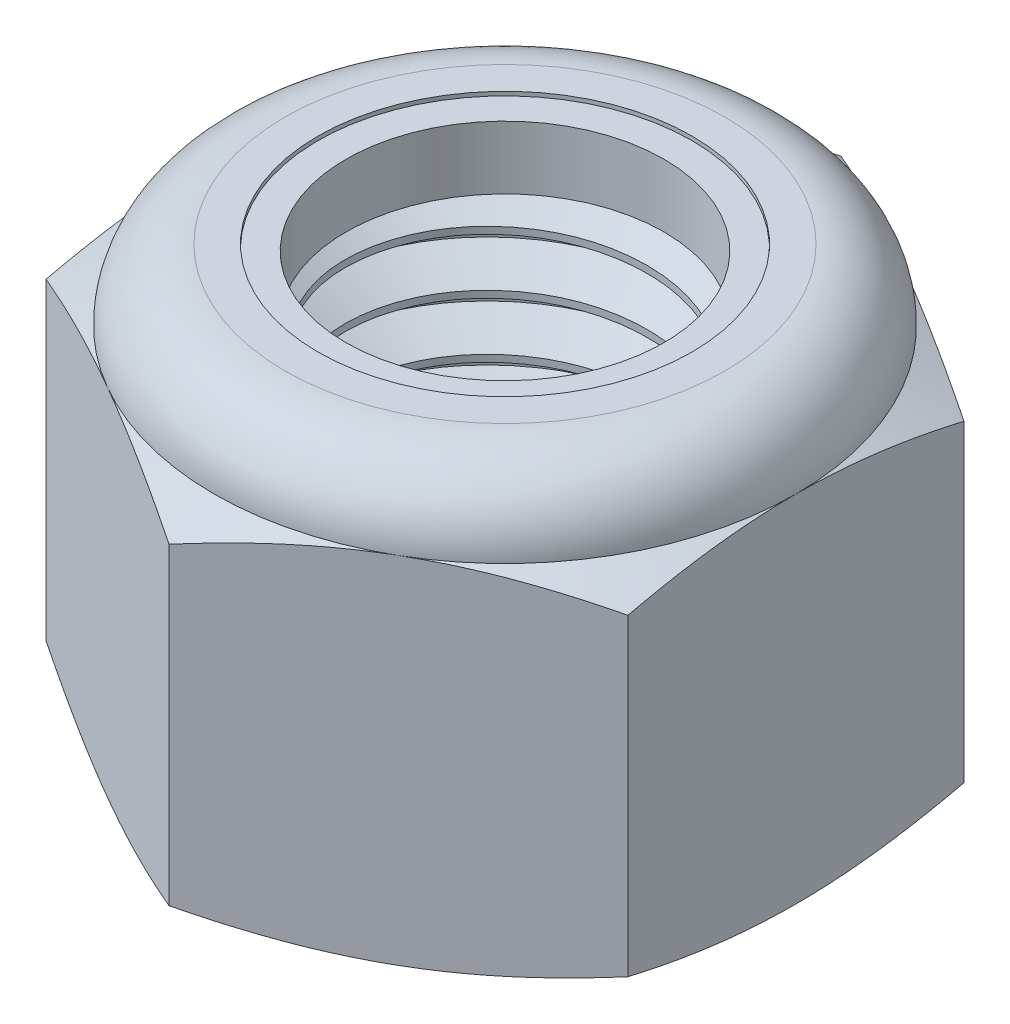
from build123d import *

# Parameters (mm, degrees)
SKETCH1_R        = 7.14375
EXTRUDE1_DEPTH   = 16.271875
SKETCH2_W        = 7.14375
SKETCH2_H        = 13.559895833
CUT_SWEEP1_PITCH = 2.116666667
SKETCH12_W       = 7.858125
SKETCH12_H       = 13.559895833


with BuildPart() as part:
    # Sketch1 → Extrude1 (new body)
    with BuildSketch(Plane(origin=(0, 0, 0), x_dir=(1, 0, 0), z_dir=(0, 1, 0))):
        Polygon((0, 12.831609733), (-11.1125, 6.415804866), (-11.1125, -6.415804866), (0, -12.831609733), (11.1125, -6.415804866), (11.1125, 6.415804866), align=None)
        with Locations(Location((0, 0, 0), (0, 0, 270))):
            Circle(SKETCH1_R, mode=Mode.SUBTRACT)
    extrude(amount=EXTRUDE1_DEPTH)

    # Sketch5 → Cut-Revolve3 (revolve, cut)
    with BuildSketch(Plane(origin=(0, 0, 0), x_dir=(0, 0, -1), z_dir=(1, 0, 0))):
        with BuildLine():
            Line((0, 0), (11.1125, 0))
            Line((11.1125, 0), (12.831609733, 0.801634034))
            Line((12.831609733, 0.801634034), (12.831609733, 12.7582618))
            Line((12.831609733, 12.7582618), (11.1125, 13.559895833))
            ThreePointArc((11.1125, 13.559895833), (10.318179693, 15.477554693), (8.400520833, 16.271875))
            Line((8.400520833, 16.271875), (8.400520833, 17.541875))
            Line((8.400520833, 17.541875), (14.101609733, 17.541875))
            Line((14.101609733, 17.541875), (14.101609733, -1.27))
            Line((14.101609733, -1.27), (0, -1.27))
            Line((0, -1.27), (0, 0))
        make_face()
    revolve(axis=Axis((0, 0, 0), (0, 1, 0)), mode=Mode.SUBTRACT)

    # Sketch6 → Cut-Revolve4 (revolve, cut)
    with BuildSketch(Plane(origin=(0, 0, 0), x_dir=(0, 0, -1), z_dir=(1, 0, 0)), mode=Mode.PRIVATE) as cut_revolve4_sk:
        with BuildLine():
            Line((0, 13.559895833), (10.9601, 13.559895833))
            ThreePointArc((10.9601, 13.559895833), (10.210416619, 15.369791619), (8.400520833, 16.119475))
            Line((8.400520833, 16.119475), (4.200260417, 16.119475))
            Line((4.200260417, 16.119475), (4.200260417, 17.541875))
            Line((4.200260417, 17.541875), (0, 17.541875))
            Line((0, 17.541875), (0, 13.559895833))
        make_face()
    revolve(cut_revolve4_sk.sketch.rotate(Axis((0, 17.541875, 0), (0, -1, 0)), 180), axis=Axis((0, 17.541875, 0), (0, -1, 0)), mode=Mode.SUBTRACT)

    # Sketch4 → Cut-Revolve2 (revolve, cut)
    with BuildSketch(Plane(origin=(0, 0, 0), x_dir=(0, 0, -1), z_dir=(1, 0, 0))):
        Polygon((0, 13.559895833), (7.858125, 13.559895833), (0, 9.895591967), align=None)
        Polygon((0, 3.664303866), (7.858125, 0), (0, 0), align=None)
    revolve(axis=Axis((0, 0, 0), (0, 1, 0)), mode=Mode.SUBTRACT)

    # Sketch12 → Revolve4 (revolve)
    with BuildSketch(Plane(origin=(0, 0, 0), x_dir=(0, 0, -1), z_dir=(1, 0, 0)), mode=Mode.PRIVATE) as revolve4_sk:
        with Locations((3.9290625, 6.779947917)):
            Rectangle(SKETCH12_W, SKETCH12_H)
    revolve(revolve4_sk.sketch.rotate(Axis((0, 0, 0), (0, 1, 0)), 315.293106021), axis=Axis((0, 0, 0), (0, 1, 0)))


with BuildPart() as body_2:
    # Sketch7 → Revolve2 (revolve)
    with BuildSketch(Plane(origin=(0, 0, 0), x_dir=(0, 0, -1), z_dir=(1, 0, 0))):
        with BuildLine():
            Line((6.0721875, 13.636095833), (10.882730664, 13.636095833))
            ThreePointArc((10.882730664, 13.636095833), (10.129384419, 15.342647299), (8.400520833, 16.043275))
            Line((8.400520833, 16.043275), (6.0721875, 16.043275))
            Line((6.0721875, 16.043275), (6.0721875, 13.636095833))
        make_face()
    revolve(axis=Axis((0, 13.636095833, 0), (0, 1, 0)))


with BuildPart() as body_3:
    # Sketch2 → Revolve1 (revolve)
    with BuildSketch(Plane(origin=(0, 0, 0), x_dir=(0, 0, -1), z_dir=(1, 0, 0))):
        with Locations((3.571875, 6.779947917)):
            Rectangle(SKETCH2_W, SKETCH2_H)
    revolve(axis=Axis((0, -7.14375, 0), (0, 1, 0)))

    # Cut-Sweep1: the profile of Sketch9 screwed along a right-hand helix of 8.6875 turns, 10 arcs to a turn; built about Z, then put on its axis
    cut_sweep1_z = Axis((0, 0, 0), (0, 0, 1))
    cut_sweep1_corners = [(7.372885888, 0, 0.132291667), (7.258317944, 0, -1.918229167), (5.768934671, 0, -1.058333333), (5.768934671, 0, -0.79375)]
    with BuildLine(mode=Mode.PRIVATE) as cut_sweep1_profile:
        Line(cut_sweep1_corners[0], cut_sweep1_corners[1])
        Line(cut_sweep1_corners[1], cut_sweep1_corners[2])
        Line(cut_sweep1_corners[2], cut_sweep1_corners[3])
        Line(cut_sweep1_corners[3], cut_sweep1_corners[0])
    cut_sweep1_cap = Face(cut_sweep1_profile.wire())
    cut_sweep1_turn_angles = [0, 18, 36, 54, 72, 90, 108, 126, 144, 162, 180, 198, 216, 234, 252, 270, 288, 306, 324, 342, 360]
    cut_sweep1_turn_weights = [1, 0.9510565162951535, 1, 0.9510565162951535, 1, 0.9510565162951535, 1, 0.9510565162951535, 1, 0.9510565162951535, 1, 0.9510565162951535, 1, 0.9510565162951535, 1, 0.9510565162951535, 1, 0.9510565162951535, 1, 0.9510565162951535, 1]
    cut_sweep1_turn_rails = [Edge.make_bspline([Vector(p[0], p[1], 0).rotate(cut_sweep1_z, cut_sweep1_turn_angles[k]) / cut_sweep1_turn_weights[k] + Vector(0, 0, p[2] + CUT_SWEEP1_PITCH * cut_sweep1_turn_angles[k] / 360) for k in range(21)], [0, 0, 0, 1, 1, 2, 2, 3, 3, 4, 4, 5, 5, 6, 6, 7, 7, 8, 8, 9, 9, 10, 10, 10], 2, cut_sweep1_turn_weights) for p in cut_sweep1_corners]
    cut_sweep1_turn_sides = [Face.make_surface_from_curves(cut_sweep1_turn_rails[p[0]], cut_sweep1_turn_rails[p[1]]) for p in [(0, 1), (1, 2), (2, 3), (3, 0)]]
    cut_sweep1_last_angles = [2880, 2898, 2916, 2934, 2952, 2970, 2988, 3006, 3024, 3042, 3060, 3078, 3096, 3111.75, 3127.5]
    cut_sweep1_last_weights = [1, 0.9510565162951535, 1, 0.9510565162951535, 1, 0.9510565162951535, 1, 0.9510565162951535, 1, 0.9510565162951535, 1, 0.9510565162951535, 1, 0.9624552364536322, 1]
    cut_sweep1_last_rails = [Edge.make_bspline([Vector(p[0], p[1], 0).rotate(cut_sweep1_z, cut_sweep1_last_angles[k]) / cut_sweep1_last_weights[k] + Vector(0, 0, p[2] + CUT_SWEEP1_PITCH * cut_sweep1_last_angles[k] / 360) for k in range(15)], [0, 0, 0, 1, 1, 2, 2, 3, 3, 4, 4, 5, 5, 6, 6, 7, 7, 7], 2, cut_sweep1_last_weights) for p in cut_sweep1_corners]
    cut_sweep1_last_sides = [Face.make_surface_from_curves(cut_sweep1_last_rails[p[0]], cut_sweep1_last_rails[p[1]]) for p in [(0, 1), (1, 2), (2, 3), (3, 0)]]
    cut_sweep1 = Plane(origin=(0, 13.559895833, 0), x_dir=(0, 0, -1), z_dir=(0, -1, 0)) * Solid(Shell([*[p.moved(Location((0, 0, CUT_SWEEP1_PITCH * i))) for i in range(8) for p in cut_sweep1_turn_sides], *cut_sweep1_last_sides, cut_sweep1_cap, cut_sweep1_cap.rotate(cut_sweep1_z, 3127.5).moved(Location((0, 0, CUT_SWEEP1_PITCH * 3127.5 / 360)))]))
    add(cut_sweep1, mode=Mode.SUBTRACT)

    # Sketch11 → Revolve3 (revolve)
    with BuildSketch(Plane(origin=(0, 0, 0), x_dir=(0, 0, -1), z_dir=(1, 0, 0))):
        Polygon((0, 0), (7.858125, 0), (0, 3.664303866), align=None)
    revolve(axis=Axis((0, 16.271875, 0), (0, -1, 0)))


with BuildPart() as part_1:
    add(part.part)

    # Combine1: cut body 3
    add(body_3.part, mode=Mode.SUBTRACT)


solid = Compound([body_2.part, part_1.part])
